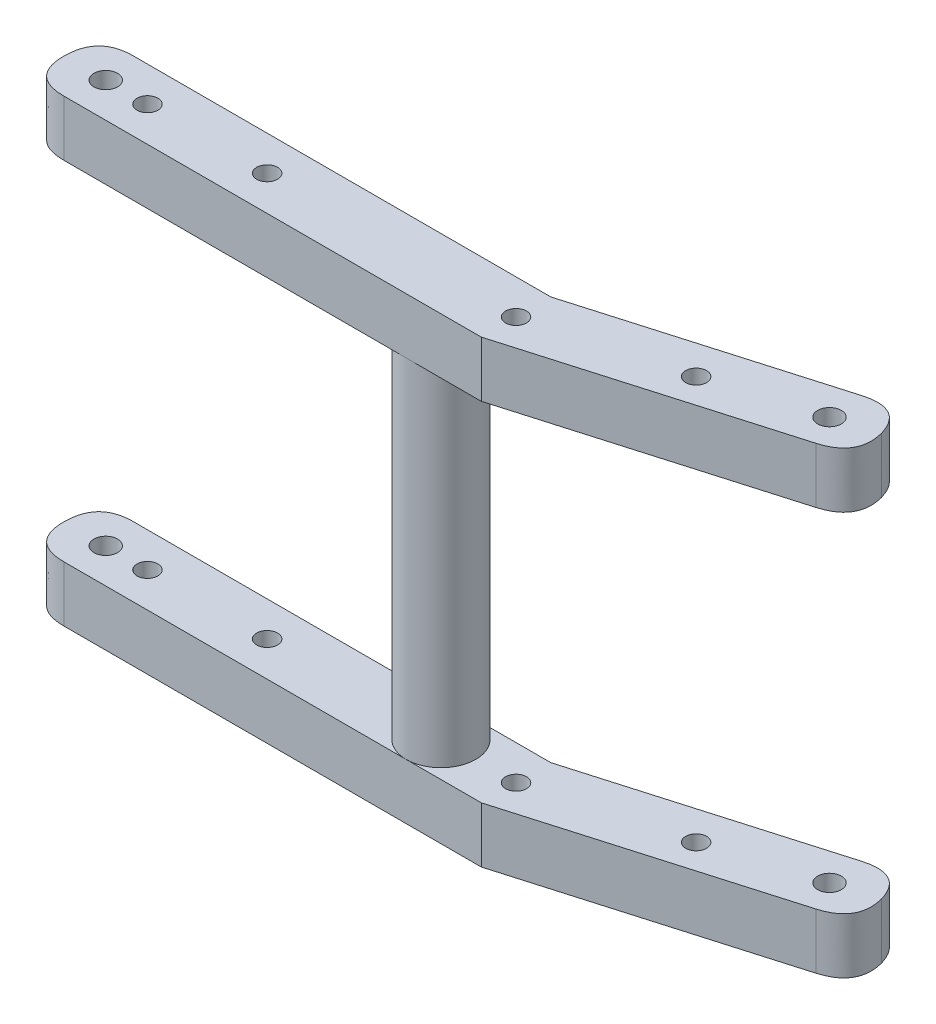
from build123d import *

# Parameters (mm, degrees)
BOSS_EXTRUDE1_DEPTH = 8
SKETCH2_R           = 1.7
SKETCH2_R_2         = 1.5
CUT_EXTRUDE1_DEPTH  = 10
FILLET1_SIZE        = 5
SKETCH3_R           = 5
BOSS_EXTRUDE2_DEPTH = 25


with BuildPart() as part:
    # Sketch1 → Boss-Extrude1 (new body)
    with BuildSketch(Plane(origin=(0, 0, 0), x_dir=(1, 0, 0), z_dir=(0, 1, 0))):
        Polygon((0, 5.796570021), (-65, 5.796570021), (-65, -4.203429979), (0, -4.203429979), (42, 8.002969552), (39.5, 17.276398151), align=None)
    extrude(amount=BOSS_EXTRUDE1_DEPTH)

    # Sketch2 → Cut-Extrude1 (cut)
    with BuildSketch(Plane(origin=(0, 8, 0), x_dir=(1, 0, 0), z_dir=(0, 1, 0))):
        with Locations(Location((-59, 0.796570021, 0), (0, 0, 270))):
            Circle(SKETCH2_R)
        with Locations(Location((-53, 0.796570021, 0), (0, 0, 270))):
            Circle(SKETCH2_R_2)
        with Locations(Location((-35.792921067, 0.796570021, 0), (0, 0, 270))):
            Circle(SKETCH2_R_2)
        with Locations(Location((20.375, 6.319841926, 0), (0, 0, 270))):
            Circle(SKETCH2_R_2)
        with Locations(Location((35.015323176, 10.860923065, 0), (0, 0, 270))):
            Circle(SKETCH2_R)
        with Locations(Location((0, 0.796570021, 0), (0, 0, 270))):
            Circle(SKETCH2_R_2)
    extrude(amount=-CUT_EXTRUDE1_DEPTH, mode=Mode.SUBTRACT)

    # Fillet1
    # a fillet whose section is not a circle: 5 mm, written as the material it takes off along each edge
    with BuildSketch(Plane(origin=(-65, -12.5, 4.203429979), x_dir=(0, 0, -1), z_dir=(0, 1, 0)), Plane(origin=(-65, -12.5, -5.796570021), x_dir=(1, 0, 0), z_dir=(0, 1, 0))) as fillet1_piece_1:
        with BuildLine():
            Bezier((FILLET1_SIZE, 0), (0, 0), (0, -FILLET1_SIZE), weights=[1, 1, 1])
            Line((0, -FILLET1_SIZE), (0, 0))
            Line((0, 0), (FILLET1_SIZE, 0))
        make_face()
    extrude(amount=33, mode=Mode.SUBTRACT)

    # Fillet2
    # a fillet whose section is not a circle: 5 mm, written as the material it takes off along each edge
    with BuildSketch(Plane(origin=(39.5, -12.746283343, -17.276398151), x_dir=(-0.9602675163397548, 0, 0.27908116572545455), z_dir=(0, 1, 0))) as fillet2_piece_1:
        with BuildLine():
            Bezier((5.098513337, 0), (0, 0), (0.099464892, 5.097543034), weights=[1, 1, 1])
            Line((0.099464892, 5.097543034), (0, 0))
            Line((0, 0), (5.098513337, 0))
        make_face()
    extrude(amount=33.492566686, mode=Mode.SUBTRACT)
    with BuildSketch(Plane(origin=(42, -12.258475337, -8.002969552), x_dir=(-0.2602945720874772, 0, -0.9655292516241013), z_dir=(0, 1, 0))) as fillet2_piece_2:
        with BuildLine():
            Bezier((4.903390135, 0), (0, 0), (-0.09565831, 4.902456966), weights=[1, 1, 1])
            Line((-0.09565831, 4.902456966), (0, 0))
            Line((0, 0), (4.903390135, 0))
        make_face()
    extrude(amount=32.516950674, mode=Mode.SUBTRACT)

    # Sketch3 → Boss-Extrude2 (add)
    with BuildSketch(Plane(origin=(0, 8, 0), x_dir=(1, 0, 0), z_dir=(0, 1, 0))):
        with Locations(Location((-10.792921067, 0.796570021, 0), (0, 0, 270))):
            Circle(SKETCH3_R)
    extrude(amount=BOSS_EXTRUDE2_DEPTH)

    # Mirror3: part across plane


with BuildPart() as part_1:
    add(part.part)
    add(part.part.mirror(Plane.ZX.offset(33)))


solid = part_1.part
